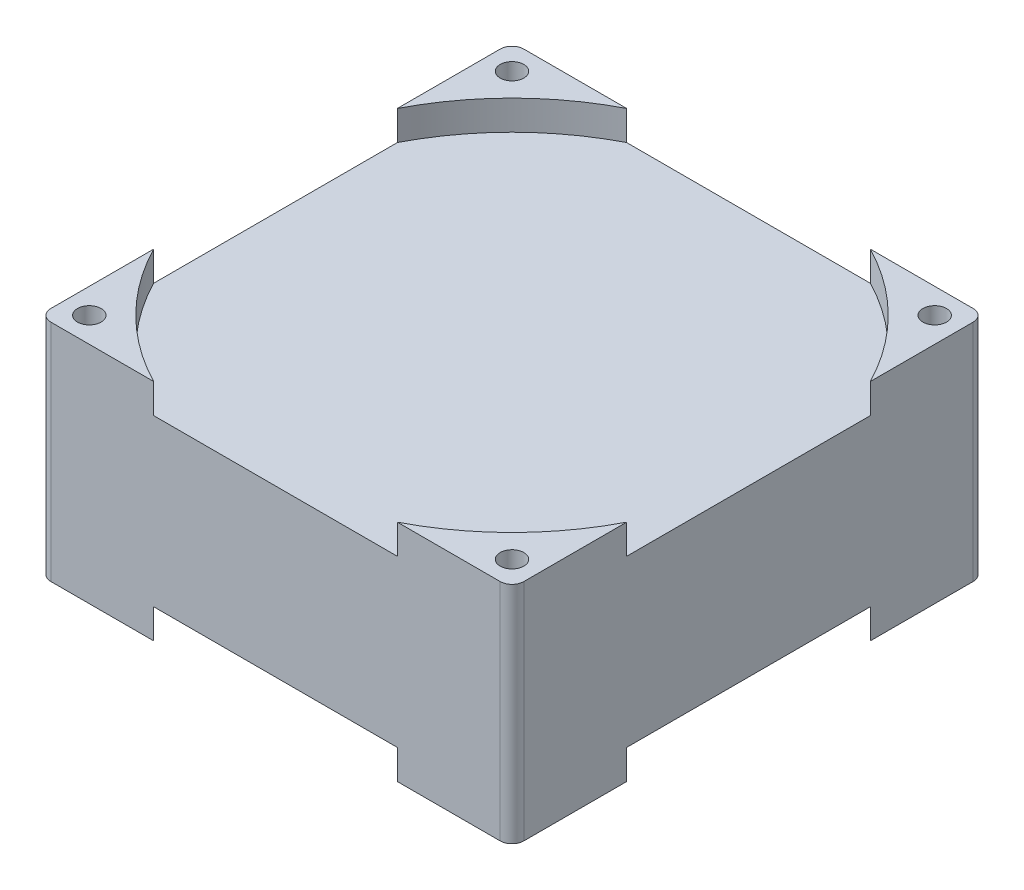
from build123d import *

# Parameters (mm, degrees)
SKETCH1_W          = 80
SKETCH1_H          = 80
BODY_DEPTH         = 38
SKETCH2_R          = 2
CUT_EXTRUDE1_DEPTH = 38
CUT_EXTRUDE2_DEPTH = 5
FILLET1_R          = 2


with BuildPart() as part:
    # Sketch1 → Body (new body)
    with BuildSketch(Plane(origin=(0, 0, 0), x_dir=(1, 0, 0), z_dir=(0, 1, 0))):
        Rectangle(SKETCH1_W, SKETCH1_H)
    extrude(amount=BODY_DEPTH)

    # Sketch2 → Cut-Extrude1 (cut)
    with BuildSketch(Plane(origin=(0, 38, 0), x_dir=(1, 0, 0), z_dir=(0, 1, 0))):
        with Locations((-35.75, 35.75)):
            Circle(SKETCH2_R)
        with Locations((35.75, 35.75)):
            Circle(SKETCH2_R)
        with Locations((35.75, -35.75)):
            Circle(SKETCH2_R)
        with Locations((-35.75, -35.75)):
            Circle(SKETCH2_R)
    extrude(amount=-CUT_EXTRUDE1_DEPTH, mode=Mode.SUBTRACT)

    # Sketch3 → Cut-Extrude2 (cut)
    with BuildSketch(Plane(origin=(0, 38, 0), x_dir=(1, 0, 0), z_dir=(0, 1, 0))):
        with BuildLine():
            Line((-40, 20.615528128), (-40, -20.615528128))
            ThreePointArc((-40, -20.615528128), (-31.819805153, -31.819805153), (-20.615528128, -40))
            Line((-20.615528128, -40), (20.615528128, -40))
            ThreePointArc((20.615528128, -40), (31.819805153, -31.819805153), (40, -20.615528128))
            Line((40, -20.615528128), (40, 20.615528128))
            ThreePointArc((40, 20.615528128), (31.819805153, 31.819805153), (20.615528128, 40))
            Line((20.615528128, 40), (-20.615528128, 40))
            ThreePointArc((-20.615528128, 40), (-31.819805153, 31.819805153), (-40, 20.615528128))
        make_face()
    cut_extrude2 = extrude(amount=-CUT_EXTRUDE2_DEPTH, mode=Mode.SUBTRACT)

    # Mirror1: Cut-Extrude2 across plane
    add(cut_extrude2.mirror(Plane.ZX.offset(19)), mode=Mode.SUBTRACT)

    # Fillet1
    fillet1_edges = [part.edges().sort_by_distance(p)[0] for p in [
        (-40, 19, 40),
        (40, 19, 40),
        (40, 19, -40),
        (-40, 19, -40),
    ]]
    fillet(fillet1_edges, radius=FILLET1_R)


solid = part.part
